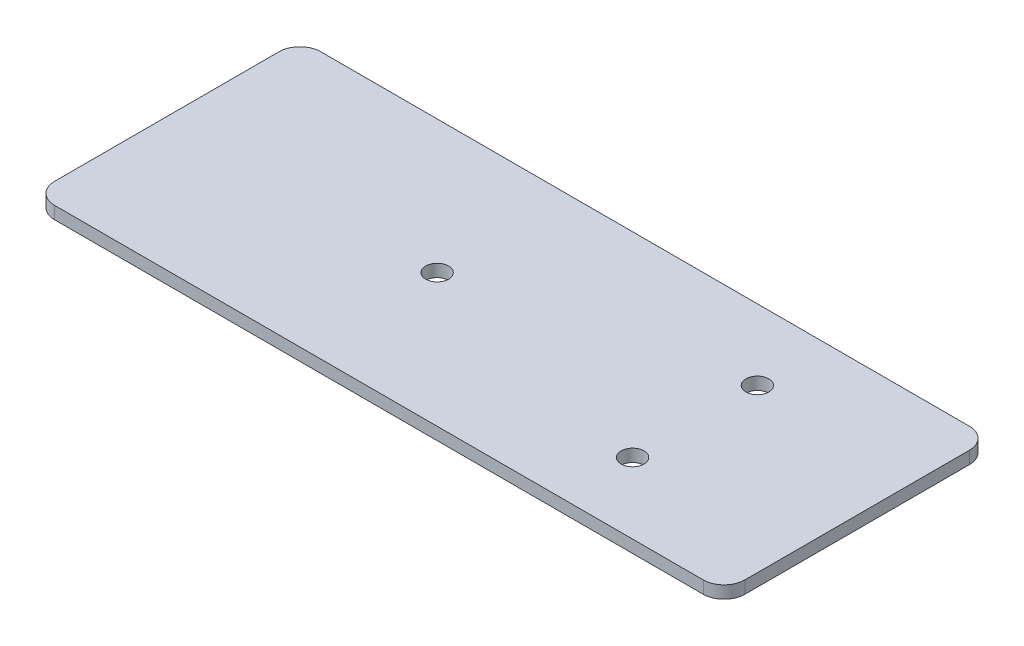
from build123d import *

# Parameters (mm, degrees)
BOSS_EXTRUDE1_DEPTH = 3
SKETCH2_R           = 2.75
CUT_EXTRUDE1_DEPTH  = 90.0056178


with BuildPart() as part:
    # Sketch1 → Boss-Extrude1 (new body)
    with BuildSketch(Plane(origin=(0, 0, 0), x_dir=(1, 0, 0), z_dir=(0, 1, 0))):
        with BuildLine():
            Line((78, 32), (-78, 32))
            ThreePointArc((-78, 32), (-81.535533906, 30.535533906), (-83, 27))
            Line((-83, 27), (-83, -27))
            ThreePointArc((-83, -27), (-81.535533906, -30.535533906), (-78, -32))
            Line((-78, -32), (78, -32))
            ThreePointArc((78, -32), (81.535533906, -30.535533906), (83, -27))
            Line((83, -27), (83, 27))
            ThreePointArc((83, 27), (81.535533906, 30.535533906), (78, 32))
        make_face()
    extrude(amount=BOSS_EXTRUDE1_DEPTH)

    # Sketch2 → Cut-Extrude1 (cut, through all)
    with BuildSketch(Plane(origin=(0, 3, 0), x_dir=(1, 0, 0), z_dir=(0, 1, 0))):
        with Locations((44, -15)):
            Circle(SKETCH2_R)
        with Locations((44, 15)):
            Circle(SKETCH2_R)
        with Locations((-18, 0)):
            Circle(SKETCH2_R)
    extrude(amount=-CUT_EXTRUDE1_DEPTH, mode=Mode.SUBTRACT)


solid = part.part
